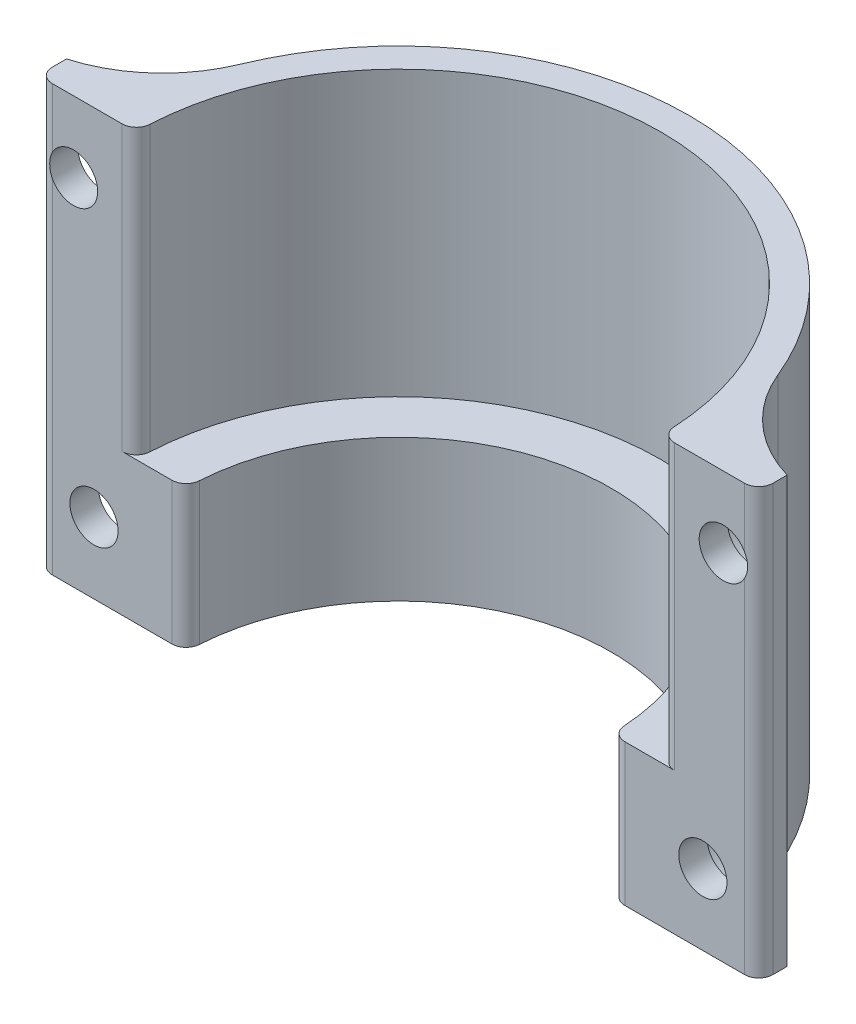
from build123d import *

# Parameters (mm, degrees)
BOSS_EXTRU_1_DEPTH         = 20
BOSS_EXTRU_2_START         = 10
BOSS_EXTRU_2_DEPTH         = 10
CONG_4_R                   = 10
PER_AGEAVANC_1_START       = 12.70456624
PER_AGEAVANC_1_OUTLINE_R   = 3.5
PER_AGEAVANC_1_DEPTH       = 5.79543376
PER_AGEAVANC_1_START_2     = 18.5
PER_AGEAVANC_1_2_OUTLINE_R = 1.7
PER_AGEAVANC_1_2_DEPTH     = 2
CONG_6_R                   = 1


# Read off the part's stored shape, not the designer's step: PerçageAvancé1
with BuildPart() as part:
    # Esquisse4 → Boss.-Extru.1 (new body)
    with BuildSketch(Plane(origin=(0, 0, 0), x_dir=(1, 0, 0), z_dir=(0, 1, 0))):
        with BuildLine():
            Line((-25.402205763, -20.5), (-25.402205763, -18.5))
            Line((-25.402205763, -18.5), (-20.402205763, -18.5))
            ThreePointArc((-20.402205763, -18.5), (0, 0), (20.402205763, -18.5))
            Line((20.402205763, -18.5), (25.402205763, -18.5))
            Line((25.402205763, -18.5), (25.402205763, -20.5))
            Line((25.402205763, -20.5), (18.5, -20.5))
            ThreePointArc((18.5, -20.5), (0, -2), (-18.5, -20.5))
            Line((-18.5, -20.5), (-25.402205763, -20.5))
        make_face()
    extrude(amount=BOSS_EXTRU_1_DEPTH)

    # Esquisse8 → Boss.-Extru.2 (add)
    with BuildSketch(Plane.XZ.offset(BOSS_EXTRU_2_START)):
        with BuildLine():
            Line((-25.402205763, 20.5), (-15, 20.5))
            ThreePointArc((-15, 20.5), (0, 5.5), (15, 20.5))
            Line((15, 20.5), (25.402205763, 20.5))
            Line((25.402205763, 20.5), (25.402205763, 18.5))
            Line((25.402205763, 18.5), (20.402205763, 18.5))
            ThreePointArc((20.402205763, 18.5), (0, 0), (-20.402205763, 18.5))
            Line((-20.402205763, 18.5), (-25.402205763, 18.5))
            Line((-25.402205763, 18.5), (-25.402205763, 20.5))
        make_face()
    extrude(amount=-BOSS_EXTRU_2_DEPTH)

    # Congé4
    # the kernel refuses this fillet: 10 mm, written as the material it adds along each edge
    with BuildSketch(Plane(origin=(20.402205763, 20, 18.5), x_dir=(1, 0, 0), z_dir=(0, -1, 0))) as cong_4_piece_1:
        with BuildLine():
            CenterArc((7.806559521, -9.598084374), CONG_4_R, 106.29935787, 51.350539993)
            Line((-1.442215982, -5.79543376), (-1.627191492, -5.719380747))
            ThreePointArc((-1.627191492, -5.719380747), (-0.703011933, -2.902220154), (-0.19904591, 0.019512195))
            Line((-0.19904591, 0.019512195), (0, 0.2))
            ThreePointArc((0, 0.2), (2.5, 0.2), (4.94386881, 0.191961687))
            Line((4.94386881, 0.191961687), (5, 0))
        make_face()
    extrude(amount=30)
    with BuildSketch(Plane(origin=(-20.402205763, 20, 18.5), x_dir=(0.241488677516522, 0, -0.9704036369631562), z_dir=(0, -1, 0))) as cong_4_piece_2:
        with BuildLine():
            CenterArc((7.42882025, -9.893342453), CONG_4_R, 98.375682161, 51.350539993)
            Line((-1.207443388, -4.852018185), (-1.38016866, -4.751191699))
            ThreePointArc((-1.38016866, -4.751191699), (-0.797802421, -2.377711357), (-0.194080727, 0.048297736))
            Line((-0.194080727, 0.048297736), (0.029132628, 0.197866849))
            ThreePointArc((0.029132628, 0.197866849), (2.986094414, -0.01864797), (5.9430562, 0.197866849))
            Line((5.9430562, 0.197866849), (5.972188828, 0))
        make_face()
    extrude(amount=30)

    # PerçageAvancé1 outline → PerçageAvancé1 (cut)
    with BuildSketch(Plane.XY.offset(PER_AGEAVANC_1_START)):
        with BuildLine():
            Line((27, 15.818747829), (25.402205763, 17.449489743))
            ThreePointArc((25.402205763, 17.449489743), (19.402205763, 15), (25.402205763, 12.550510257))
            Line((25.402205763, 12.550510257), (27, 14.181252171))
            Line((27, 14.181252171), (27, 15.818747829))
        make_face()
        with BuildLine():
            Line((-25.402205763, 17.449489743), (-27, 15.818747829))
            Line((-27, 15.818747829), (-27, 14.181252171))
            Line((-27, 14.181252171), (-25.402205763, 12.550510257))
            ThreePointArc((-25.402205763, 12.550510257), (-19.402205763, 15), (-25.402205763, 17.449489743))
        make_face()
        with Locations((21.460868066, -5)):
            Circle(PER_AGEAVANC_1_OUTLINE_R)
        with Locations((-21.460868066, -5)):
            Circle(PER_AGEAVANC_1_OUTLINE_R)
    extrude(amount=PER_AGEAVANC_1_DEPTH, mode=Mode.SUBTRACT)

    # Per_ageAvanc_1 2 outline → Per_ageAvanc_1 2 (cut)
    with BuildSketch(Plane.XY.offset(PER_AGEAVANC_1_START_2)):
        with Locations((22.902205763, 15)):
            Circle(PER_AGEAVANC_1_2_OUTLINE_R)
        with Locations((21.460868066, -5)):
            Circle(PER_AGEAVANC_1_2_OUTLINE_R)
        with Locations((-21.460868066, -5)):
            Circle(PER_AGEAVANC_1_2_OUTLINE_R)
        with Locations((-22.902205763, 15)):
            Circle(PER_AGEAVANC_1_2_OUTLINE_R)
    extrude(amount=PER_AGEAVANC_1_2_DEPTH, mode=Mode.SUBTRACT)

    # Congé6
    # the kernel refuses this fillet: 1 mm, written as the material it takes off along each edge
    with BuildSketch(Plane(origin=(25.402205763, -12.5, 20.5), x_dir=(-1, 0, 0), z_dir=(0, 1, 0))) as cong_6_piece_1:
        with BuildLine():
            CenterArc((CONG_6_R, -CONG_6_R), CONG_6_R, 90, 90)
            Line((0, -CONG_6_R), (0, 0))
            Line((0, 0), (CONG_6_R, 0))
        make_face()
    extrude(amount=35, mode=Mode.SUBTRACT)
    with BuildSketch(Plane(origin=(18.5, 0, 20.5), x_dir=(-0.02564946435665691, 0, -0.9996709983680714), z_dir=(0, 1, 0))) as cong_6_piece_2:
        with BuildLine():
            CenterArc((0.974679646, -0.999670998), CONG_6_R, 91.469767243, 87.060465514)
            Line((-0.024991353, -0.974021534), (0, 0))
            ThreePointArc((0, 0), (0.474515091, -0.00608653), (0.949030181, 0))
        make_face()
    extrude(amount=22.435855235, mode=Mode.SUBTRACT)
    with BuildSketch(Plane(origin=(-18.5, 0, 20.5), x_dir=(-1, 0, 0), z_dir=(0, 1, 0))) as cong_6_piece_3:
        with BuildLine():
            CenterArc((0.974342094, -1), CONG_6_R, 90, 87.060465514)
            ThreePointArc((-0.024342116, -0.948717949), (-0.00608653, -0.474515091), (0, 0))
            Line((0, 0), (0.974342094, 0))
        make_face()
    extrude(amount=22.435855235, mode=Mode.SUBTRACT)
    with BuildSketch(Plane(origin=(-25.402205763, 22.5, 20.5), x_dir=(0, 0, -1), z_dir=(0, -1, 0))) as cong_6_piece_4:
        with BuildLine():
            CenterArc((CONG_6_R, CONG_6_R), CONG_6_R, 180, 90)
            Line((0, CONG_6_R), (0, 0))
            Line((0, 0), (CONG_6_R, 0))
        make_face()
    extrude(amount=35, mode=Mode.SUBTRACT)
    with BuildSketch(Plane(origin=(15, -12.421798557, 20.5), x_dir=(1, 0, 0), z_dir=(0, 1, 0))) as cong_6_piece_5:
        with BuildLine():
            CenterArc((0.968719423, 1), CONG_6_R, 183.583321698, 86.416678302)
            ThreePointArc((-0.029325541, 0.9375), (-0.007333178, 0.468979274), (0, 0))
            Line((0, 0), (0.968719423, 0))
        make_face()
    extrude(amount=14.843597113, mode=Mode.SUBTRACT)
    with BuildSketch(Plane(origin=(-15, -12.421798557, 20.5), x_dir=(-1, 0, 0), z_dir=(0, 1, 0))) as cong_6_piece_6:
        with BuildLine():
            CenterArc((0.968719423, -1), CONG_6_R, 90, 86.416678302)
            ThreePointArc((-0.029325541, -0.9375), (-0.007333178, -0.468979274), (0, 0))
            Line((0, 0), (0.968719423, 0))
        make_face()
    extrude(amount=14.843597113, mode=Mode.SUBTRACT)


solid = part.part
